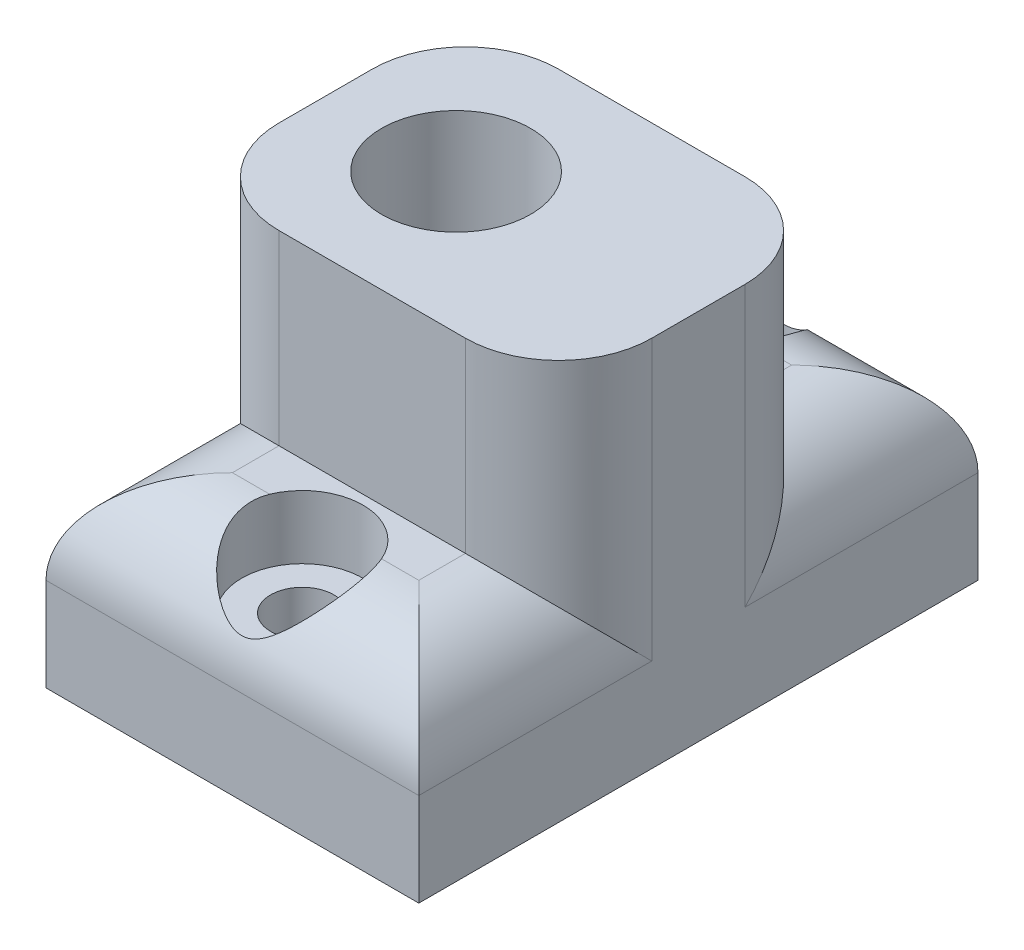
from build123d import *

# Parameters (mm, degrees)
SKETCH1_W                                           = 20
SKETCH1_H                                           = 30
BOSS_EXTRUDE1_DEPTH                                 = 20
SKETCH2_R                                           = 4
CUT_EXTRUDE1_DEPTH                                  = 10
SKETCH3_W                                           = 20
SKETCH3_H                                           = 7.5
CUT_EXTRUDE2_DEPTH                                  = 10
CBORE_FOR_M3_HEX_SOCKET_HEAD_CAP_SCREW1_D           = 3.4
CBORE_FOR_M3_HEX_SOCKET_HEAD_CAP_SCREW1_CBORE_D     = 6.5
CBORE_FOR_M3_HEX_SOCKET_HEAD_CAP_SCREW1_CBORE_DEPTH = 3.4
FILLET2_R                                           = 5


with BuildPart() as part:
    # Sketch1 → Boss-Extrude1 (new body)
    with BuildSketch(Plane(origin=(0, 0, 0), x_dir=(1, 0, 0), z_dir=(0, 1, 0))):
        Rectangle(SKETCH1_W, SKETCH1_H)
    extrude(amount=BOSS_EXTRUDE1_DEPTH)

    # Sketch2 → Cut-Extrude1 (cut)
    with BuildSketch(Plane(origin=(0, 20, 0), x_dir=(1, 0, 0), z_dir=(0, 1, 0))):
        with Locations(Location((-3, 0, 0), (0, 0, 270))):
            Circle(SKETCH2_R)
    extrude(amount=-CUT_EXTRUDE1_DEPTH, mode=Mode.SUBTRACT)

    # Sketch3 → Cut-Extrude2 (cut)
    with BuildSketch(Plane(origin=(0, 20, 0), x_dir=(1, 0, 0), z_dir=(0, 1, 0))):
        with Locations((0, -11.25)):
            Rectangle(SKETCH3_W, SKETCH3_H)
        with Locations((0, 11.25)):
            Rectangle(SKETCH3_W, SKETCH3_H)
    extrude(amount=-CUT_EXTRUDE2_DEPTH, mode=Mode.SUBTRACT)

    # CBORE for M3 Hex Socket Head Cap Screw1 (through all)
    with Locations(Plane(origin=(0, 10, 0), x_dir=(1, 0, 0), z_dir=(0, 1, 0))):
        with Locations((0, -11.25), (0, 11.25)):
            CounterBoreHole(CBORE_FOR_M3_HEX_SOCKET_HEAD_CAP_SCREW1_D / 2, CBORE_FOR_M3_HEX_SOCKET_HEAD_CAP_SCREW1_CBORE_D / 2, CBORE_FOR_M3_HEX_SOCKET_HEAD_CAP_SCREW1_CBORE_DEPTH)

    # Fillet2
    # the kernel refuses this fillet: 5 mm, written as the material it takes off along each edge
    with BuildSketch(Plane(origin=(-10, 10, 7.5), x_dir=(1, 0, 0), z_dir=(0, 0, 1)), Plane(origin=(-10, 10, -7.5), x_dir=(0, -1, 0), z_dir=(0, 0, -1)), Plane(origin=(10, 10, -15), x_dir=(0, -1, 0), z_dir=(0, 0, 1))) as fillet2_piece_1:
        with BuildLine():
            CenterArc((FILLET2_R, -FILLET2_R), FILLET2_R, 90, 90)
            Line((0, -FILLET2_R), (-FILLET2_R * 0.02, -FILLET2_R))
            Line((-FILLET2_R * 0.02, -FILLET2_R), (-FILLET2_R * 0.02, FILLET2_R * 0.02))
            Line((-FILLET2_R * 0.02, FILLET2_R * 0.02), (FILLET2_R, FILLET2_R * 0.02))
            Line((FILLET2_R, FILLET2_R * 0.02), (FILLET2_R, 0))
        make_face()
    extrude(amount=7.5, mode=Mode.SUBTRACT)
    with BuildSketch(Plane(origin=(-10, 20, 7.5), x_dir=(0, 0, -1), z_dir=(0, -1, 0)), Plane(origin=(10, 20, -7.5), x_dir=(0, 0, 1), z_dir=(0, -1, 0))) as fillet2_piece_2:
        with BuildLine():
            CenterArc((FILLET2_R, FILLET2_R), FILLET2_R, 180, 90)
            Line((0, FILLET2_R), (-FILLET2_R * 0.02, FILLET2_R))
            Line((-FILLET2_R * 0.02, FILLET2_R), (-FILLET2_R * 0.02, -FILLET2_R * 0.02))
            Line((-FILLET2_R * 0.02, -FILLET2_R * 0.02), (FILLET2_R, -FILLET2_R * 0.02))
            Line((FILLET2_R, -FILLET2_R * 0.02), (FILLET2_R, 0))
        make_face()
    extrude(amount=10, mode=Mode.SUBTRACT)
    with BuildSketch(Plane(origin=(10, 10, 15), x_dir=(0, -1, 0), z_dir=(0, 0, -1))) as fillet2_piece_3:
        with BuildLine():
            CenterArc((FILLET2_R, FILLET2_R), FILLET2_R, 180, 90)
            Line((0, FILLET2_R), (-FILLET2_R * 0.02, FILLET2_R))
            Line((-FILLET2_R * 0.02, FILLET2_R), (-FILLET2_R * 0.02, -FILLET2_R * 0.02))
            Line((-FILLET2_R * 0.02, -FILLET2_R * 0.02), (FILLET2_R, -FILLET2_R * 0.02))
            Line((FILLET2_R, -FILLET2_R * 0.02), (FILLET2_R, 0))
        make_face()
    extrude(amount=7.5, mode=Mode.SUBTRACT)
    with BuildSketch(Plane(origin=(10, 20, 7.5), x_dir=(0, 0, -1), z_dir=(0, -1, 0)), Plane(origin=(-10, 20, -7.5), x_dir=(0, 0, 1), z_dir=(0, -1, 0))) as fillet2_piece_4:
        with BuildLine():
            CenterArc((FILLET2_R, -FILLET2_R), FILLET2_R, 90, 90)
            Line((0, -FILLET2_R), (-FILLET2_R * 0.02, -FILLET2_R))
            Line((-FILLET2_R * 0.02, -FILLET2_R), (-FILLET2_R * 0.02, FILLET2_R * 0.02))
            Line((-FILLET2_R * 0.02, FILLET2_R * 0.02), (FILLET2_R, FILLET2_R * 0.02))
            Line((FILLET2_R, FILLET2_R * 0.02), (FILLET2_R, 0))
        make_face()
    extrude(amount=10, mode=Mode.SUBTRACT)
    with BuildSketch(Plane(origin=(-10, 10, 15), x_dir=(0, -1, 0), z_dir=(1, 0, 0))) as fillet2_piece_5:
        with BuildLine():
            CenterArc((FILLET2_R, FILLET2_R), FILLET2_R, 180, 90)
            Line((0, FILLET2_R), (-FILLET2_R * 0.02, FILLET2_R))
            Line((-FILLET2_R * 0.02, FILLET2_R), (-FILLET2_R * 0.02, -FILLET2_R * 0.02))
            Line((-FILLET2_R * 0.02, -FILLET2_R * 0.02), (FILLET2_R, -FILLET2_R * 0.02))
            Line((FILLET2_R, -FILLET2_R * 0.02), (FILLET2_R, 0))
        make_face()
    extrude(amount=20, mode=Mode.SUBTRACT)
    with BuildSketch(Plane(origin=(-10, 10, -15), x_dir=(0, -1, 0), z_dir=(1, 0, 0))) as fillet2_piece_6:
        with BuildLine():
            CenterArc((FILLET2_R, -FILLET2_R), FILLET2_R, 90, 90)
            Line((0, -FILLET2_R), (-FILLET2_R * 0.02, -FILLET2_R))
            Line((-FILLET2_R * 0.02, -FILLET2_R), (-FILLET2_R * 0.02, FILLET2_R * 0.02))
            Line((-FILLET2_R * 0.02, FILLET2_R * 0.02), (FILLET2_R, FILLET2_R * 0.02))
            Line((FILLET2_R, FILLET2_R * 0.02), (FILLET2_R, 0))
        make_face()
    extrude(amount=20, mode=Mode.SUBTRACT)
    with BuildSketch(Plane(origin=(-10, 10, -5), x_dir=(1, 0, 0), z_dir=(0, 0, 1))) as fillet2_piece_7a_section:
        with BuildLine():
            CenterArc((FILLET2_R, -FILLET2_R), FILLET2_R, 90, 90)
            Line((0, -FILLET2_R), (-FILLET2_R * 0.02, -FILLET2_R))
            Line((-FILLET2_R * 0.02, -FILLET2_R), (-FILLET2_R * 0.02, FILLET2_R * 0.02))
            Line((-FILLET2_R * 0.02, FILLET2_R * 0.02), (FILLET2_R, FILLET2_R * 0.02))
            Line((FILLET2_R, FILLET2_R * 0.02), (FILLET2_R, 0))
        make_face()
    fillet2_piece_7a = extrude(amount=20, mode=Mode.PRIVATE)
    fillet2_piece_7a = split(fillet2_piece_7a, bisect_by=Plane(origin=(-8.868024429, 8.868024429, 7.5), z_dir=(0, 0, -1)), keep=Keep.TOP, mode=Mode.PRIVATE)
    with BuildSketch(Plane(origin=(-10, 20, 7.5), x_dir=(0, 0, -1), z_dir=(0, -1, 0))) as fillet2_piece_7b_section:
        with BuildLine():
            CenterArc((FILLET2_R, FILLET2_R), FILLET2_R, 180, 90)
            Line((0, FILLET2_R), (-FILLET2_R * 0.02, FILLET2_R))
            Line((-FILLET2_R * 0.02, FILLET2_R), (-FILLET2_R * 0.02, -FILLET2_R * 0.02))
            Line((-FILLET2_R * 0.02, -FILLET2_R * 0.02), (FILLET2_R, -FILLET2_R * 0.02))
            Line((FILLET2_R, -FILLET2_R * 0.02), (FILLET2_R, 0))
        make_face()
    fillet2_piece_7b = extrude(amount=22.5, mode=Mode.PRIVATE)
    fillet2_piece_7b = split(fillet2_piece_7b, bisect_by=Plane(origin=(-8.868024429, 10, 6.368024429), z_dir=(0, -1, 0)), keep=Keep.TOP, mode=Mode.PRIVATE)
    fillet2_piece_7 = fillet2_piece_7a & fillet2_piece_7b
    add(fillet2_piece_7, mode=Mode.SUBTRACT)
    with BuildSketch(Plane(origin=(-22.5, 10, 15), x_dir=(0, -1, 0), z_dir=(1, 0, 0))) as fillet2_piece_8a_section:
        with BuildLine():
            CenterArc((FILLET2_R, FILLET2_R), FILLET2_R, 180, 90)
            Line((0, FILLET2_R), (-FILLET2_R * 0.02, FILLET2_R))
            Line((-FILLET2_R * 0.02, FILLET2_R), (-FILLET2_R * 0.02, -FILLET2_R * 0.02))
            Line((-FILLET2_R * 0.02, -FILLET2_R * 0.02), (FILLET2_R, -FILLET2_R * 0.02))
            Line((FILLET2_R, -FILLET2_R * 0.02), (FILLET2_R, 0))
        make_face()
    fillet2_piece_8a = extrude(amount=32.5, mode=Mode.PRIVATE)
    fillet2_piece_8a = split(fillet2_piece_8a, bisect_by=Plane(origin=(-10, 8.868024429, 13.868024429), z_dir=(-1, 0, 0)), keep=Keep.TOP, mode=Mode.PRIVATE)
    with BuildSketch(Plane(origin=(-10, 10, 7.5), x_dir=(1, 0, 0), z_dir=(0, 0, 1))) as fillet2_piece_8b_section:
        with BuildLine():
            CenterArc((FILLET2_R, -FILLET2_R), FILLET2_R, 90, 90)
            Line((0, -FILLET2_R), (-FILLET2_R * 0.02, -FILLET2_R))
            Line((-FILLET2_R * 0.02, -FILLET2_R), (-FILLET2_R * 0.02, FILLET2_R * 0.02))
            Line((-FILLET2_R * 0.02, FILLET2_R * 0.02), (FILLET2_R, FILLET2_R * 0.02))
            Line((FILLET2_R, FILLET2_R * 0.02), (FILLET2_R, 0))
        make_face()
    fillet2_piece_8b = extrude(amount=20, mode=Mode.PRIVATE)
    fillet2_piece_8b = split(fillet2_piece_8b, bisect_by=Plane(origin=(-8.868024429, 8.868024429, 15), z_dir=(0, 0, 1)), keep=Keep.TOP, mode=Mode.PRIVATE)
    fillet2_piece_8 = fillet2_piece_8a & fillet2_piece_8b
    add(fillet2_piece_8, mode=Mode.SUBTRACT)
    with BuildSketch(Plane(origin=(-10, 10, 15), x_dir=(0, -1, 0), z_dir=(1, 0, 0))) as fillet2_piece_9a_section:
        with BuildLine():
            CenterArc((FILLET2_R, FILLET2_R), FILLET2_R, 180, 90)
            Line((0, FILLET2_R), (-FILLET2_R * 0.02, FILLET2_R))
            Line((-FILLET2_R * 0.02, FILLET2_R), (-FILLET2_R * 0.02, -FILLET2_R * 0.02))
            Line((-FILLET2_R * 0.02, -FILLET2_R * 0.02), (FILLET2_R, -FILLET2_R * 0.02))
            Line((FILLET2_R, -FILLET2_R * 0.02), (FILLET2_R, 0))
        make_face()
    fillet2_piece_9a = extrude(amount=32.5, mode=Mode.PRIVATE)
    fillet2_piece_9a = split(fillet2_piece_9a, bisect_by=Plane(origin=(10, 8.868024429, 13.868024429), z_dir=(1, 0, 0)), keep=Keep.TOP, mode=Mode.PRIVATE)
    with BuildSketch(Plane(origin=(10, 10, 27.5), x_dir=(0, -1, 0), z_dir=(0, 0, -1))) as fillet2_piece_9b_section:
        with BuildLine():
            CenterArc((FILLET2_R, FILLET2_R), FILLET2_R, 180, 90)
            Line((0, FILLET2_R), (-FILLET2_R * 0.02, FILLET2_R))
            Line((-FILLET2_R * 0.02, FILLET2_R), (-FILLET2_R * 0.02, -FILLET2_R * 0.02))
            Line((-FILLET2_R * 0.02, -FILLET2_R * 0.02), (FILLET2_R, -FILLET2_R * 0.02))
            Line((FILLET2_R, -FILLET2_R * 0.02), (FILLET2_R, 0))
        make_face()
    fillet2_piece_9b = extrude(amount=20, mode=Mode.PRIVATE)
    fillet2_piece_9b = split(fillet2_piece_9b, bisect_by=Plane(origin=(8.868024429, 8.868024429, 15), z_dir=(0, 0, 1)), keep=Keep.TOP, mode=Mode.PRIVATE)
    fillet2_piece_9 = fillet2_piece_9a & fillet2_piece_9b
    add(fillet2_piece_9, mode=Mode.SUBTRACT)
    with BuildSketch(Plane(origin=(10, 20, 7.5), x_dir=(0, 0, -1), z_dir=(0, -1, 0))) as fillet2_piece_10a_section:
        with BuildLine():
            CenterArc((FILLET2_R, -FILLET2_R), FILLET2_R, 90, 90)
            Line((0, -FILLET2_R), (-FILLET2_R * 0.02, -FILLET2_R))
            Line((-FILLET2_R * 0.02, -FILLET2_R), (-FILLET2_R * 0.02, FILLET2_R * 0.02))
            Line((-FILLET2_R * 0.02, FILLET2_R * 0.02), (FILLET2_R, FILLET2_R * 0.02))
            Line((FILLET2_R, FILLET2_R * 0.02), (FILLET2_R, 0))
        make_face()
    fillet2_piece_10a = extrude(amount=22.5, mode=Mode.PRIVATE)
    fillet2_piece_10a = split(fillet2_piece_10a, bisect_by=Plane(origin=(8.868024429, 10, 6.368024429), z_dir=(0, -1, 0)), keep=Keep.TOP, mode=Mode.PRIVATE)
    with BuildSketch(Plane(origin=(10, 10, 15), x_dir=(0, -1, 0), z_dir=(0, 0, -1))) as fillet2_piece_10b_section:
        with BuildLine():
            CenterArc((FILLET2_R, FILLET2_R), FILLET2_R, 180, 90)
            Line((0, FILLET2_R), (-FILLET2_R * 0.02, FILLET2_R))
            Line((-FILLET2_R * 0.02, FILLET2_R), (-FILLET2_R * 0.02, -FILLET2_R * 0.02))
            Line((-FILLET2_R * 0.02, -FILLET2_R * 0.02), (FILLET2_R, -FILLET2_R * 0.02))
            Line((FILLET2_R, -FILLET2_R * 0.02), (FILLET2_R, 0))
        make_face()
    fillet2_piece_10b = extrude(amount=20, mode=Mode.PRIVATE)
    fillet2_piece_10b = split(fillet2_piece_10b, bisect_by=Plane(origin=(8.868024429, 8.868024429, 7.5), z_dir=(0, 0, -1)), keep=Keep.TOP, mode=Mode.PRIVATE)
    fillet2_piece_10 = fillet2_piece_10a & fillet2_piece_10b
    add(fillet2_piece_10, mode=Mode.SUBTRACT)
    with BuildSketch(Plane(origin=(-10, 20, -7.5), x_dir=(0, 0, 1), z_dir=(0, -1, 0))) as fillet2_piece_11a_section:
        with BuildLine():
            CenterArc((FILLET2_R, -FILLET2_R), FILLET2_R, 90, 90)
            Line((0, -FILLET2_R), (-FILLET2_R * 0.02, -FILLET2_R))
            Line((-FILLET2_R * 0.02, -FILLET2_R), (-FILLET2_R * 0.02, FILLET2_R * 0.02))
            Line((-FILLET2_R * 0.02, FILLET2_R * 0.02), (FILLET2_R, FILLET2_R * 0.02))
            Line((FILLET2_R, FILLET2_R * 0.02), (FILLET2_R, 0))
        make_face()
    fillet2_piece_11a = extrude(amount=22.5, mode=Mode.PRIVATE)
    fillet2_piece_11a = split(fillet2_piece_11a, bisect_by=Plane(origin=(-8.868024429, 10, -6.368024429), z_dir=(0, -1, 0)), keep=Keep.TOP, mode=Mode.PRIVATE)
    with BuildSketch(Plane(origin=(-10, 10, 5), x_dir=(0, -1, 0), z_dir=(0, 0, -1))) as fillet2_piece_11b_section:
        with BuildLine():
            CenterArc((FILLET2_R, -FILLET2_R), FILLET2_R, 90, 90)
            Line((0, -FILLET2_R), (-FILLET2_R * 0.02, -FILLET2_R))
            Line((-FILLET2_R * 0.02, -FILLET2_R), (-FILLET2_R * 0.02, FILLET2_R * 0.02))
            Line((-FILLET2_R * 0.02, FILLET2_R * 0.02), (FILLET2_R, FILLET2_R * 0.02))
            Line((FILLET2_R, FILLET2_R * 0.02), (FILLET2_R, 0))
        make_face()
    fillet2_piece_11b = extrude(amount=20, mode=Mode.PRIVATE)
    fillet2_piece_11b = split(fillet2_piece_11b, bisect_by=Plane(origin=(-8.868024429, 8.868024429, -7.5), z_dir=(0, 0, 1)), keep=Keep.TOP, mode=Mode.PRIVATE)
    fillet2_piece_11 = fillet2_piece_11a & fillet2_piece_11b
    add(fillet2_piece_11, mode=Mode.SUBTRACT)
    with BuildSketch(Plane(origin=(-10, 10, -7.5), x_dir=(0, -1, 0), z_dir=(0, 0, -1))) as fillet2_piece_12a_section:
        with BuildLine():
            CenterArc((FILLET2_R, -FILLET2_R), FILLET2_R, 90, 90)
            Line((0, -FILLET2_R), (-FILLET2_R * 0.02, -FILLET2_R))
            Line((-FILLET2_R * 0.02, -FILLET2_R), (-FILLET2_R * 0.02, FILLET2_R * 0.02))
            Line((-FILLET2_R * 0.02, FILLET2_R * 0.02), (FILLET2_R, FILLET2_R * 0.02))
            Line((FILLET2_R, FILLET2_R * 0.02), (FILLET2_R, 0))
        make_face()
    fillet2_piece_12a = extrude(amount=20, mode=Mode.PRIVATE)
    fillet2_piece_12a = split(fillet2_piece_12a, bisect_by=Plane(origin=(-8.868024429, 8.868024429, -15), z_dir=(0, 0, -1)), keep=Keep.TOP, mode=Mode.PRIVATE)
    with BuildSketch(Plane(origin=(-22.5, 10, -15), x_dir=(0, -1, 0), z_dir=(1, 0, 0))) as fillet2_piece_12b_section:
        with BuildLine():
            CenterArc((FILLET2_R, -FILLET2_R), FILLET2_R, 90, 90)
            Line((0, -FILLET2_R), (-FILLET2_R * 0.02, -FILLET2_R))
            Line((-FILLET2_R * 0.02, -FILLET2_R), (-FILLET2_R * 0.02, FILLET2_R * 0.02))
            Line((-FILLET2_R * 0.02, FILLET2_R * 0.02), (FILLET2_R, FILLET2_R * 0.02))
            Line((FILLET2_R, FILLET2_R * 0.02), (FILLET2_R, 0))
        make_face()
    fillet2_piece_12b = extrude(amount=32.5, mode=Mode.PRIVATE)
    fillet2_piece_12b = split(fillet2_piece_12b, bisect_by=Plane(origin=(-10, 8.868024429, -13.868024429), z_dir=(-1, 0, 0)), keep=Keep.TOP, mode=Mode.PRIVATE)
    fillet2_piece_12 = fillet2_piece_12a & fillet2_piece_12b
    add(fillet2_piece_12, mode=Mode.SUBTRACT)
    with BuildSketch(Plane(origin=(10, 10, -27.5), x_dir=(0, -1, 0), z_dir=(0, 0, 1))) as fillet2_piece_13a_section:
        with BuildLine():
            CenterArc((FILLET2_R, -FILLET2_R), FILLET2_R, 90, 90)
            Line((0, -FILLET2_R), (-FILLET2_R * 0.02, -FILLET2_R))
            Line((-FILLET2_R * 0.02, -FILLET2_R), (-FILLET2_R * 0.02, FILLET2_R * 0.02))
            Line((-FILLET2_R * 0.02, FILLET2_R * 0.02), (FILLET2_R, FILLET2_R * 0.02))
            Line((FILLET2_R, FILLET2_R * 0.02), (FILLET2_R, 0))
        make_face()
    fillet2_piece_13a = extrude(amount=20, mode=Mode.PRIVATE)
    fillet2_piece_13a = split(fillet2_piece_13a, bisect_by=Plane(origin=(8.868024429, 8.868024429, -15), z_dir=(0, 0, -1)), keep=Keep.TOP, mode=Mode.PRIVATE)
    with BuildSketch(Plane(origin=(-10, 10, -15), x_dir=(0, -1, 0), z_dir=(1, 0, 0))) as fillet2_piece_13b_section:
        with BuildLine():
            CenterArc((FILLET2_R, -FILLET2_R), FILLET2_R, 90, 90)
            Line((0, -FILLET2_R), (-FILLET2_R * 0.02, -FILLET2_R))
            Line((-FILLET2_R * 0.02, -FILLET2_R), (-FILLET2_R * 0.02, FILLET2_R * 0.02))
            Line((-FILLET2_R * 0.02, FILLET2_R * 0.02), (FILLET2_R, FILLET2_R * 0.02))
            Line((FILLET2_R, FILLET2_R * 0.02), (FILLET2_R, 0))
        make_face()
    fillet2_piece_13b = extrude(amount=32.5, mode=Mode.PRIVATE)
    fillet2_piece_13b = split(fillet2_piece_13b, bisect_by=Plane(origin=(10, 8.868024429, -13.868024429), z_dir=(1, 0, 0)), keep=Keep.TOP, mode=Mode.PRIVATE)
    fillet2_piece_13 = fillet2_piece_13a & fillet2_piece_13b
    add(fillet2_piece_13, mode=Mode.SUBTRACT)
    with BuildSketch(Plane(origin=(10, 10, -15), x_dir=(0, -1, 0), z_dir=(0, 0, 1))) as fillet2_piece_14a_section:
        with BuildLine():
            CenterArc((FILLET2_R, -FILLET2_R), FILLET2_R, 90, 90)
            Line((0, -FILLET2_R), (-FILLET2_R * 0.02, -FILLET2_R))
            Line((-FILLET2_R * 0.02, -FILLET2_R), (-FILLET2_R * 0.02, FILLET2_R * 0.02))
            Line((-FILLET2_R * 0.02, FILLET2_R * 0.02), (FILLET2_R, FILLET2_R * 0.02))
            Line((FILLET2_R, FILLET2_R * 0.02), (FILLET2_R, 0))
        make_face()
    fillet2_piece_14a = extrude(amount=20, mode=Mode.PRIVATE)
    fillet2_piece_14a = split(fillet2_piece_14a, bisect_by=Plane(origin=(8.868024429, 8.868024429, -7.5), z_dir=(0, 0, 1)), keep=Keep.TOP, mode=Mode.PRIVATE)
    with BuildSketch(Plane(origin=(10, 20, -7.5), x_dir=(0, 0, 1), z_dir=(0, -1, 0))) as fillet2_piece_14b_section:
        with BuildLine():
            CenterArc((FILLET2_R, FILLET2_R), FILLET2_R, 180, 90)
            Line((0, FILLET2_R), (-FILLET2_R * 0.02, FILLET2_R))
            Line((-FILLET2_R * 0.02, FILLET2_R), (-FILLET2_R * 0.02, -FILLET2_R * 0.02))
            Line((-FILLET2_R * 0.02, -FILLET2_R * 0.02), (FILLET2_R, -FILLET2_R * 0.02))
            Line((FILLET2_R, -FILLET2_R * 0.02), (FILLET2_R, 0))
        make_face()
    fillet2_piece_14b = extrude(amount=22.5, mode=Mode.PRIVATE)
    fillet2_piece_14b = split(fillet2_piece_14b, bisect_by=Plane(origin=(8.868024429, 10, -6.368024429), z_dir=(0, -1, 0)), keep=Keep.TOP, mode=Mode.PRIVATE)
    fillet2_piece_14 = fillet2_piece_14a & fillet2_piece_14b
    add(fillet2_piece_14, mode=Mode.SUBTRACT)


solid = part.part
